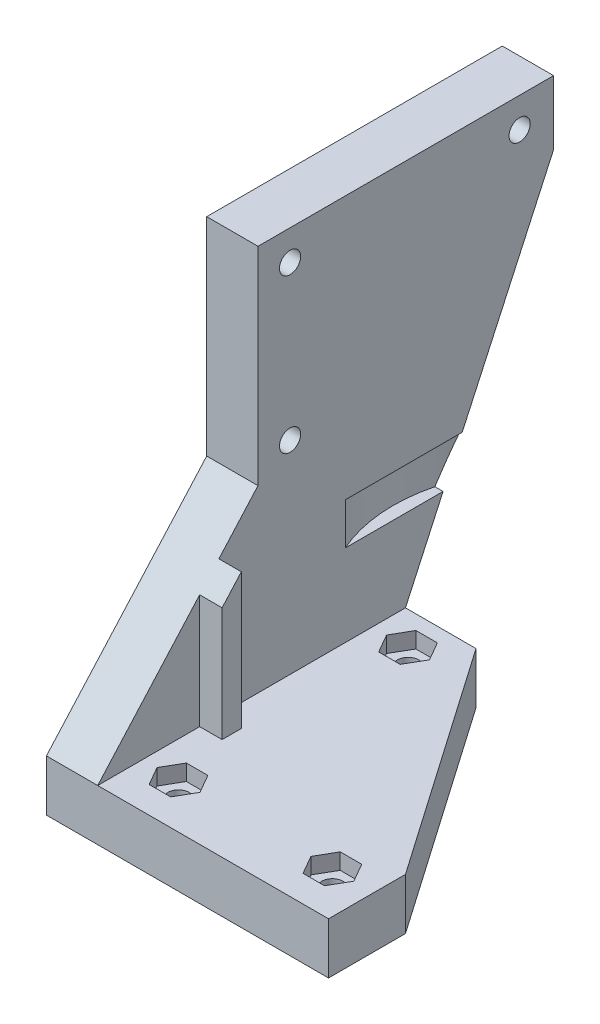
from build123d import *

# Parameters (mm, degrees)
SKETCH1_R           = 1.65
BOSS_EXTRUDE1_DEPTH = 8
SKETCH3_R           = 1.65
BOSS_EXTRUDE2_DEPTH = 8
CUT_EXTRUDE1_DEPTH  = 2.5
BOSS_EXTRUDE3_DEPTH = 3.5
SKETCH6_W           = 23.5
SKETCH6_H           = 6.5


with BuildPart() as part:
    # Sketch1 → Boss-Extrude1 (new body)
    with BuildSketch(Plane(origin=(0, 0, 0), x_dir=(1, 0, 0), z_dir=(0, 1, 0))):
        Polygon((-30.201635745, 21.458760302), (-19.201635745, 21.458760302), (5.798364255, -14.541239698), (5.798364255, -26.541239698), (-30.201635745, -26.541239698), align=None)
        with Locations((-24.651635745, 16.308760302)):
            Circle(SKETCH1_R, mode=Mode.SUBTRACT)
        with Locations((-24.651635745, -19.491239698)):
            Circle(SKETCH1_R, mode=Mode.SUBTRACT)
        with Locations((-0.651635745, -19.491239698)):
            Circle(SKETCH1_R, mode=Mode.SUBTRACT)
    extrude(amount=BOSS_EXTRUDE1_DEPTH)

    # Sketch3 → Boss-Extrude2 (add)
    with BuildSketch(Plane.ZY.offset(30.201635745)):
        Polygon((-44.558757353, 58.334529743), (-21.458760302, 8), (-21.458760302, 0), (26.541239698, 0), (26.541239698, 8), (1.541239698, 36), (1.541239698, 68.334529743), (-44.558757353, 68.334529743), align=None)
        with Locations((-3.458760302, 39.65)):
            Circle(SKETCH3_R, mode=Mode.SUBTRACT)
        with Locations((-3.458760302, 63.65)):
            Circle(SKETCH3_R, mode=Mode.SUBTRACT)
        with Locations((-39.258757353, 63.664529743)):
            Circle(SKETCH3_R, mode=Mode.SUBTRACT)
    extrude(amount=BOSS_EXTRUDE2_DEPTH)

    # Sketch4 → Cut-Extrude1 (cut)
    with BuildSketch(Plane(origin=(0, 8, 0), x_dir=(1, 0, 0), z_dir=(0, 1, 0))):
        Polygon((-26.326635745, 13.407575199), (-22.976635745, 13.407575199), (-21.301635745, 16.308760302), (-22.976635745, 19.209945405), (-26.326635745, 19.209945405), (-28.001635745, 16.308760302), align=None)
        Polygon((-22.976635745, -16.590054595), (-26.326635745, -16.590054595), (-28.001635745, -19.491239698), (-26.326635745, -22.392424801), (-22.976635745, -22.392424801), (-21.301635745, -19.491239698), align=None)
        Polygon((1.023364255, -16.590054595), (-2.326635745, -16.590054595), (-4.001635745, -19.491239698), (-2.326635745, -22.392424801), (1.023364255, -22.392424801), (2.698364255, -19.491239698), align=None)
    extrude(amount=-CUT_EXTRUDE1_DEPTH, mode=Mode.SUBTRACT)

    # Sketch5 → Boss-Extrude3 (add)
    with BuildSketch(Plane(origin=(-30.201635745, 0, 0), x_dir=(0, 0, -1), z_dir=(1, 0, 0))):
        Polygon((-10.641239698, 8), (-7.641239698, 8), (-7.641239698, 29.168), (-10.641239698, 25.808), align=None)
    extrude(amount=BOSS_EXTRUDE3_DEPTH)

    # Sketch6 → Cut-Revolve1 (revolve, cut)
    with BuildSketch(Plane(origin=(0, 0, -21.558757353), x_dir=(-1, 0, 0), z_dir=(0, 0, -1))):
        with Locations((20.451635745, 24.034529743)):
            Rectangle(SKETCH6_W, SKETCH6_H)
    revolve(axis=Axis((-8.701635745, 4.983273513, -21.558757353), (0, 1, 0)), mode=Mode.SUBTRACT)


solid = part.part
